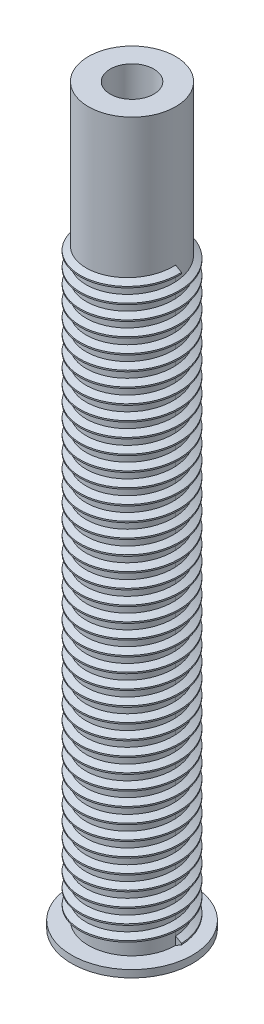
from build123d import *
from build123d.topology import SkipClean

# Parameters (mm, degrees)
SKETCH1_R           = 6
BOSS_EXTRUDE1_DEPTH = 100
THREAD1_PITCH       = 2
SKETCH4_R           = 3
CUT_EXTRUDE1_DEPTH  = 19
SKETCH5_R           = 8.315605174
BOSS_EXTRUDE2_DEPTH = 1


with BuildPart() as part:
    # Sketch1 → Boss-Extrude1 (new body)
    with BuildSketch(Plane(origin=(0, 0, 0), x_dir=(1, 0, 0), z_dir=(0, 1, 0))):
        with Locations(Location((0, 0, 0), (0, 0, 270))):
            Circle(SKETCH1_R)
    extrude(amount=BOSS_EXTRUDE1_DEPTH)

    # Thread1: the profile of Thread Profile1 profile screwed along a right-hand helix of 40 turns, 10 arcs to a turn; built about Z, then put on its axis
    with SkipClean():  # the faces are left unmerged after this step: merging them gives an invalid solid
        thread1_z = Axis((0, 0, 0), (0, 0, 1))
        thread1_corners = [(5.9997, 0, -0.000173205), (6.811898813, 0, 0.468749998), (6.811898813, 0, 0.656249998), (5.9997, 0, 1.125173201)]
        with BuildLine(mode=Mode.PRIVATE) as thread1_profile:
            Line(thread1_corners[0], thread1_corners[1])
            Line(thread1_corners[1], thread1_corners[2])
            Line(thread1_corners[2], thread1_corners[3])
            Line(thread1_corners[3], thread1_corners[0])
        thread1_cap = Face(thread1_profile.wire())
        thread1_turn_angles = [0, 18, 36, 54, 72, 90, 108, 126, 144, 162, 180, 198, 216, 234, 252, 270, 288, 306, 324, 342, 360, 378, 396, 414, 432, 450, 468, 486, 504, 522, 540, 558, 576, 594, 612, 630, 648, 666, 684, 702, 720]
        thread1_turn_weights = [1, 0.9510565162951535, 1, 0.9510565162951535, 1, 0.9510565162951535, 1, 0.9510565162951535, 1, 0.9510565162951535, 1, 0.9510565162951535, 1, 0.9510565162951535, 1, 0.9510565162951535, 1, 0.9510565162951535, 1, 0.9510565162951535, 1, 0.9510565162951535, 1, 0.9510565162951535, 1, 0.9510565162951535, 1, 0.9510565162951535, 1, 0.9510565162951535, 1, 0.9510565162951535, 1, 0.9510565162951535, 1, 0.9510565162951535, 1, 0.9510565162951535, 1, 0.9510565162951535, 1]
        thread1_turn_rails = [Edge.make_bspline([Vector(p[0], p[1], 0).rotate(thread1_z, thread1_turn_angles[k]) / thread1_turn_weights[k] + Vector(0, 0, p[2] + THREAD1_PITCH * thread1_turn_angles[k] / 360) for k in range(41)], [0, 0, 0, 1, 1, 2, 2, 3, 3, 4, 4, 5, 5, 6, 6, 7, 7, 8, 8, 9, 9, 10, 10, 11, 11, 12, 12, 13, 13, 14, 14, 15, 15, 16, 16, 17, 17, 18, 18, 19, 19, 20, 20, 20], 2, thread1_turn_weights) for p in thread1_corners]
        thread1_turn_sides = [Face.make_surface_from_curves(thread1_turn_rails[p[0]], thread1_turn_rails[p[1]]) for p in [(0, 1), (1, 2), (2, 3), (3, 0)]]
        thread1 = Plane(origin=(0, 0, 0), x_dir=(1, 0, 0), z_dir=(0, 1, 0)) * Solid(Shell([*[p.moved(Location((0, 0, 2 * THREAD1_PITCH * i))) for i in range(20) for p in thread1_turn_sides], thread1_cap, thread1_cap.rotate(thread1_z, 14400).moved(Location((0, 0, THREAD1_PITCH * 14400 / 360)))]))
        add(thread1)

    # Sketch4 → Cut-Extrude1 (cut)
    with SkipClean():  # the faces are left unmerged after this step: merging them gives an invalid solid
        with BuildSketch(Plane(origin=(0, 100, 0), x_dir=(1, 0, 0), z_dir=(0, 1, 0))):
            with Locations(Location((0, 0, 0), (0, 0, 270))):
                Circle(SKETCH4_R)
        extrude(amount=-CUT_EXTRUDE1_DEPTH, mode=Mode.SUBTRACT)

    # Sketch5 → Boss-Extrude2 (add)
    with SkipClean():  # the faces are left unmerged after this step: merging them gives an invalid solid
        with BuildSketch(Plane.XZ):
            with Locations(Location((0, 0, 0), (0, 0, 270))):
                Circle(SKETCH5_R)
        extrude(amount=BOSS_EXTRUDE2_DEPTH)


solid = part.part
